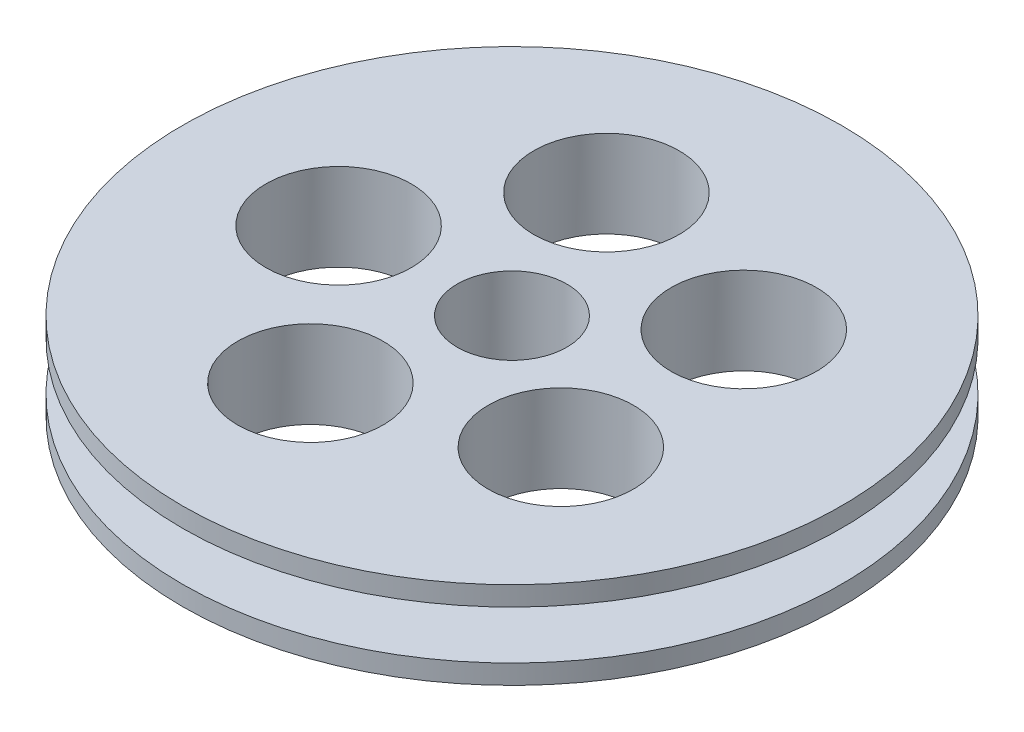
from build123d import *

# Parameters (mm, degrees)
SKETCH3_R          = 5.653749864
SKETCH3_R_2        = 7.5
CUT_EXTRUDE1_DEPTH = 10


with BuildPart() as part:
    # Sketch1 → Revolve4 (revolve)
    with BuildSketch(Plane(origin=(0, 0, 0), x_dir=(0, 0, -1), z_dir=(1, 0, 0))):
        Polygon((0, -2), (30, -2), (30, 0), (22, 0), (22, 5), (30, 5), (30, 7), (0, 7), align=None)
    revolve(axis=Axis((0, 2.5, 4), (0, 1, 0)))

    # Sketch3 → Cut-Extrude1 (cut)
    with BuildSketch(Plane(origin=(0, 7, 0), x_dir=(1, 0, 0), z_dir=(0, 1, 0))):
        with Locations((0, -4)):
            Circle(SKETCH3_R)
        with Locations((-16.975218646, -4.917579386)):
            Circle(SKETCH3_R_2)
        with Locations((-6.118300899, 11.860844685)):
            Circle(SKETCH3_R_2)
        with Locations((13.193900737, 6.720120492)):
            Circle(SKETCH3_R_2)
        with Locations((14.272579999, -13.235445857)):
            Circle(SKETCH3_R_2)
        with Locations((-4.37296119, -20.427939933)):
            Circle(SKETCH3_R_2)
    extrude(amount=-CUT_EXTRUDE1_DEPTH, mode=Mode.SUBTRACT)


solid = part.part
